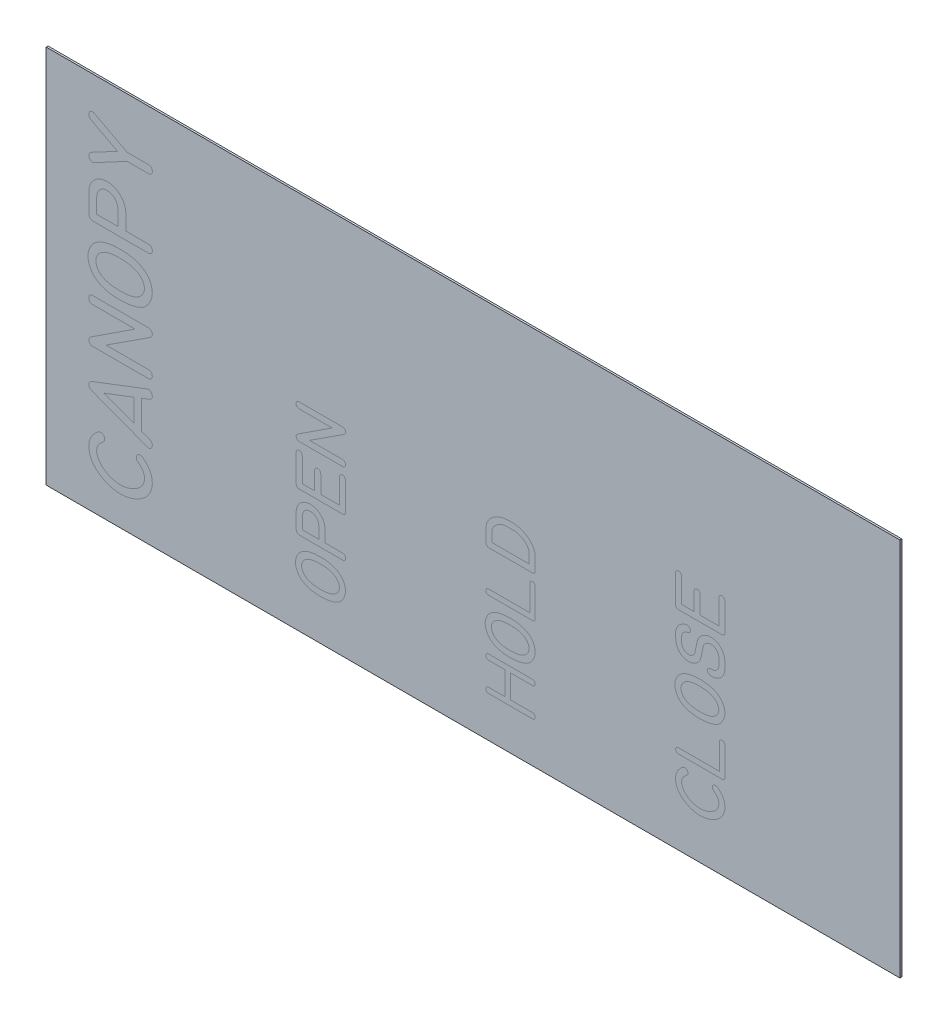
from build123d import *

# Parameters (mm, degrees)
SKETCH1_W           = 57.15
SKETCH1_H           = 25.4
BOSS_EXTRUDE1_DEPTH = 0.127


with BuildPart() as part:
    # Sketch1 → Boss-Extrude1 (new body)
    with BuildSketch(Plane.XY):
        with Locations((-3237.650995584, 6184.9)):
            Rectangle(SKETCH1_W, SKETCH1_H)
    extrude(amount=BOSS_EXTRUDE1_DEPTH)


solid = part.part
